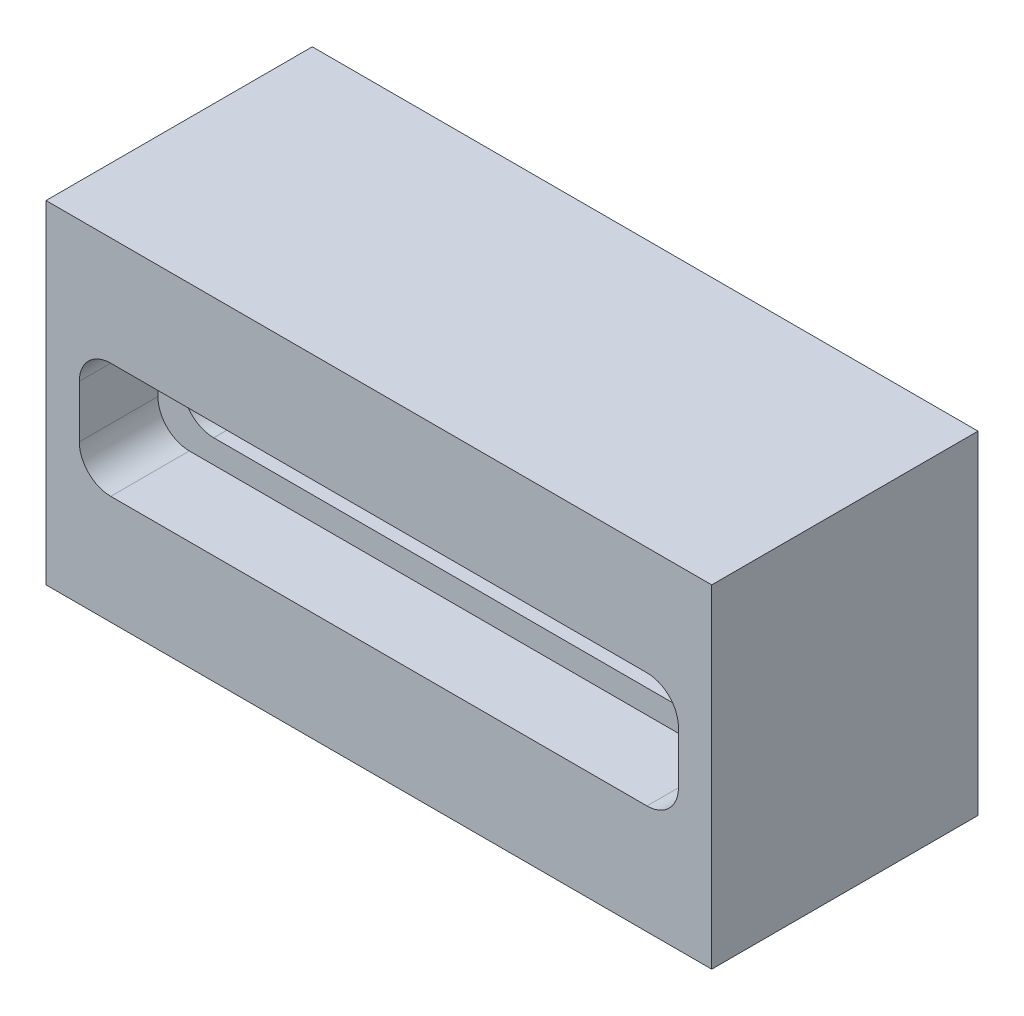
from build123d import *

# Parameters (mm, degrees)
SKETCH1_W           = 127
SKETCH1_H           = 50.8
BOSS_EXTRUDE1_DEPTH = 63.5
CUT_EXTRUDE2_DEPTH  = 15
CUT_EXTRUDE3_DEPTH  = 151.804144505


with BuildPart() as part:
    # Sketch1 → Boss-Extrude1 (new body)
    with BuildSketch(Plane(origin=(0, 0, 0), x_dir=(1, 0, 0), z_dir=(0, 1, 0))):
        with Locations((63.5, 25.4)):
            Rectangle(SKETCH1_W, SKETCH1_H)
    extrude(amount=BOSS_EXTRUDE1_DEPTH)

    # Sketch3 → Cut-Extrude2 (cut)
    with BuildSketch(Plane.XY):
        with BuildLine():
            Line((12.35, 42.8), (114.65, 42.8))
            ThreePointArc((114.65, 42.8), (118.892640687, 41.042640687), (120.65, 36.8))
            Line((120.65, 36.8), (120.65, 26.8))
            ThreePointArc((120.65, 26.8), (118.892640687, 22.557359313), (114.65, 20.8))
            Line((114.65, 20.8), (12.35, 20.8))
            ThreePointArc((12.35, 20.8), (8.107359313, 22.557359313), (6.35, 26.8))
            Line((6.35, 26.8), (6.35, 36.8))
            ThreePointArc((6.35, 36.8), (8.107359313, 41.042640687), (12.35, 42.8))
        make_face()
    extrude(amount=-CUT_EXTRUDE2_DEPTH, mode=Mode.SUBTRACT)

    # Sketch2 → Cut-Extrude3 (cut, through all)
    with BuildSketch(Plane.XY):
        with BuildLine():
            Line((17, 38.3), (110, 38.3))
            ThreePointArc((110, 38.3), (114.242640687, 36.542640687), (116, 32.3))
            Line((116, 32.3), (116, 31.3))
            ThreePointArc((116, 31.3), (114.242640687, 27.057359313), (110, 25.3))
            Line((110, 25.3), (17, 25.3))
            ThreePointArc((17, 25.3), (12.757359313, 27.057359313), (11, 31.3))
            Line((11, 31.3), (11, 32.3))
            ThreePointArc((11, 32.3), (12.757359313, 36.542640687), (17, 38.3))
        make_face()
    extrude(amount=-CUT_EXTRUDE3_DEPTH, mode=Mode.SUBTRACT)


solid = part.part
